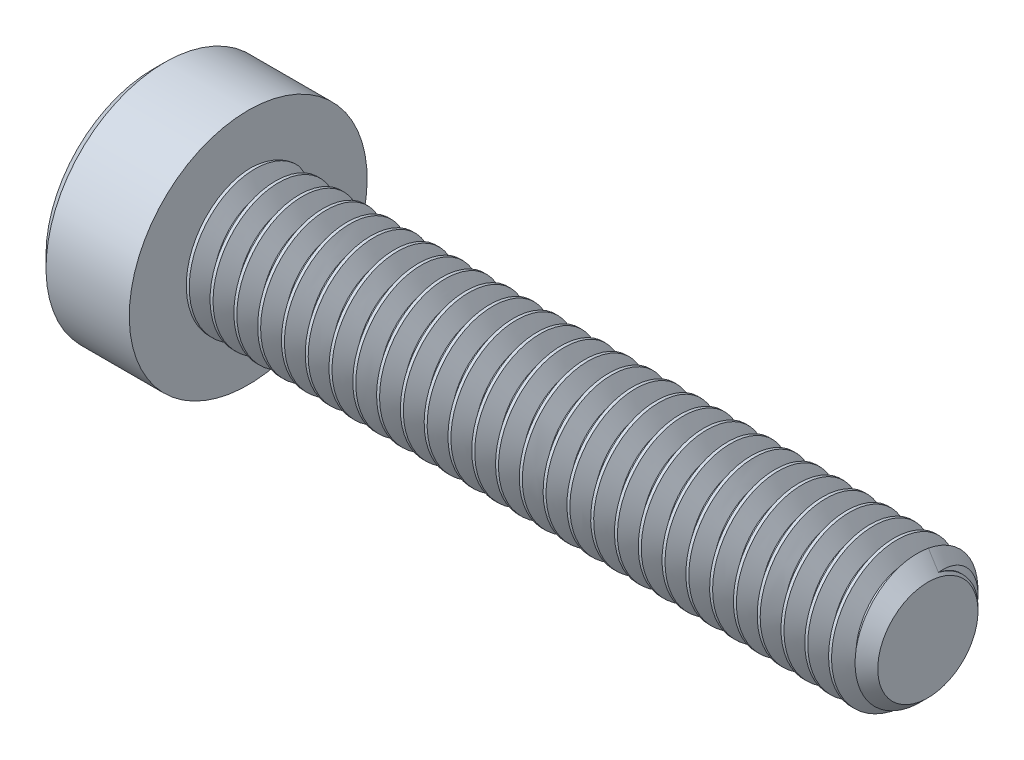
from build123d import *

# Parameters (mm, degrees)
SKETCH2_R           = 2
BOSS_EXTRUDE1_DEPTH = 20
CHAMFER1_SIZE       = 0.525
CUT_SWEEP1_PITCH    = 0.7
CUT_EXTRUDE1_DEPTH  = 2.42


with BuildPart() as part:
    # Sketch2 → Boss-Extrude1 (new body)
    with BuildSketch(Plane(origin=(10, 0, 0), x_dir=(0, 0, -1), z_dir=(1, 0, 0))):
        Circle(SKETCH2_R)
    extrude(amount=-BOSS_EXTRUDE1_DEPTH)

    # Chamfer1
    chamfer1_edges = [part.edges().sort_by_distance(p)[0] for p in [
        (10, 0, 2),
    ]]
    chamfer(chamfer1_edges, length=CHAMFER1_SIZE)

    # Cut-Sweep1: the profile of Sketch5 profile screwed along a right-hand helix of 29.526792 turns, 6 arcs to a turn; built about Z, then put on its axis
    cut_sweep1_z = Axis((0, 0, 0), (0, 0, 1))
    cut_sweep1_corners = [(2.0003, 0, 0.306423205), (2.0003, 0, -0.306423205), (1.545336663, 0, -0.04375), (1.545336663, 0, 0.04375)]
    with BuildLine(mode=Mode.PRIVATE) as cut_sweep1_profile:
        Line(cut_sweep1_corners[0], cut_sweep1_corners[1])
        Line(cut_sweep1_corners[1], cut_sweep1_corners[2])
        Line(cut_sweep1_corners[2], cut_sweep1_corners[3])
        Line(cut_sweep1_corners[3], cut_sweep1_corners[0])
    cut_sweep1_cap = Face(cut_sweep1_profile.wire())
    cut_sweep1_turn_angles = [0, 30, 60, 90, 120, 150, 180, 210, 240, 270, 300, 330, 360]
    cut_sweep1_turn_weights = [1, 0.8660254037844387, 1, 0.8660254037844387, 1, 0.8660254037844387, 1, 0.8660254037844387, 1, 0.8660254037844387, 1, 0.8660254037844387, 1]
    cut_sweep1_turn_rails = [Edge.make_bspline([Vector(p[0], p[1], 0).rotate(cut_sweep1_z, cut_sweep1_turn_angles[k]) / cut_sweep1_turn_weights[k] + Vector(0, 0, p[2] + CUT_SWEEP1_PITCH * cut_sweep1_turn_angles[k] / 360) for k in range(13)], [0, 0, 0, 1, 1, 2, 2, 3, 3, 4, 4, 5, 5, 6, 6, 6], 2, cut_sweep1_turn_weights) for p in cut_sweep1_corners]
    cut_sweep1_turn_sides = [Face.make_surface_from_curves(cut_sweep1_turn_rails[p[0]], cut_sweep1_turn_rails[p[1]]) for p in [(0, 1), (1, 2), (2, 3), (3, 0)]]
    cut_sweep1_last_angles = [10440, 10470, 10500, 10530, 10560, 10590, 10620, 10624.822513714, 10629.645027429]
    cut_sweep1_last_weights = [1, 0.8660254037844387, 1, 0.8660254037844387, 1, 0.8660254037844387, 1, 0.9964599020793568, 1]
    cut_sweep1_last_rails = [Edge.make_bspline([Vector(p[0], p[1], 0).rotate(cut_sweep1_z, cut_sweep1_last_angles[k]) / cut_sweep1_last_weights[k] + Vector(0, 0, p[2] + CUT_SWEEP1_PITCH * cut_sweep1_last_angles[k] / 360) for k in range(9)], [0, 0, 0, 1, 1, 2, 2, 3, 3, 4, 4, 4], 2, cut_sweep1_last_weights) for p in cut_sweep1_corners]
    cut_sweep1_last_sides = [Face.make_surface_from_curves(cut_sweep1_last_rails[p[0]], cut_sweep1_last_rails[p[1]]) for p in [(0, 1), (1, 2), (2, 3), (3, 0)]]
    cut_sweep1 = Plane(origin=(10, 0, 0), x_dir=(0, 1, 0), z_dir=(-1, 0, 0)) * Solid(Shell([*[p.moved(Location((0, 0, CUT_SWEEP1_PITCH * i))) for i in range(29) for p in cut_sweep1_turn_sides], *cut_sweep1_last_sides, cut_sweep1_cap, cut_sweep1_cap.rotate(cut_sweep1_z, 10629.645027429).moved(Location((0, 0, CUT_SWEEP1_PITCH * 10629.645027429 / 360)))]))
    add(cut_sweep1, mode=Mode.SUBTRACT)

    # Sketch6 → Revolve1 (revolve)
    with BuildSketch(Plane.XY, mode=Mode.PRIVATE) as revolve1_sk:
        Polygon((-12.45, 3.5), (-12.8, 3.15), (-12.8, 0), (-10, 0), (-10, 3.5), align=None)
    revolve(revolve1_sk.sketch.rotate(Axis((-10, 0, 0), (-1, 0, 0)), 14.209880149), axis=Axis((-10, 0, 0), (-1, 0, 0)))

    # Sketch4 → Cut-Extrude1 (cut)
    with BuildSketch(Plane(origin=(-12.8, 0, 0), x_dir=(0, 0, -1), z_dir=(1, 0, 0))):
        Polygon((0, 1.443375673), (-1.25, 0.721687836), (-1.25, -0.721687836), (0, -1.443375673), (1.25, -0.721687836), (1.25, 0.721687836), align=None)
    extrude(amount=CUT_EXTRUDE1_DEPTH, mode=Mode.SUBTRACT)

    # Cut-Extrude2 cone 1 section (through the dimple's axis) → Cut-Extrude2 (revolve, cut)
    with BuildSketch(Plane(origin=(-12.8, 0, 0), x_dir=(0, 0, 1), z_dir=(0, 1, 0))):
        Polygon((0, 0), (1.443375673, 0), (0, 1.443375673), align=None)
    revolve(axis=Axis((-12.8, 0, 0), (1, 0, 0)), mode=Mode.SUBTRACT)


solid = part.part
